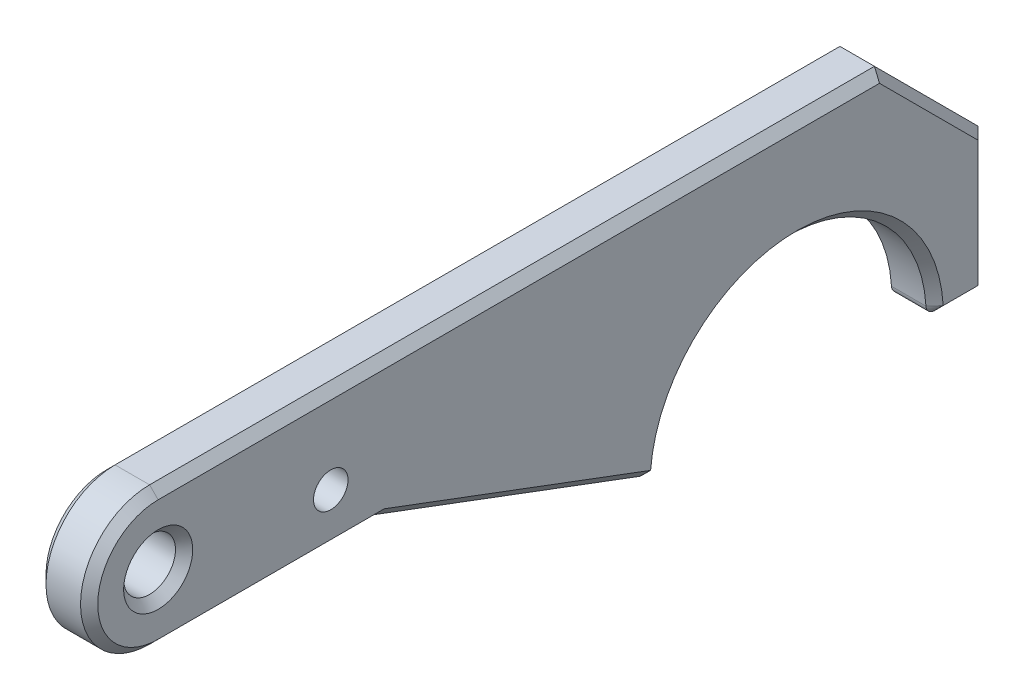
from build123d import *

# Parameters (mm, degrees)
SKETCH1_R           = 4.7625
BOSS_EXTRUDE1_DEPTH = 4.7625
FILLET1_R           = 1.5875
CHAMFER1_SIZE       = 19.05
CHAMFER2_SIZE       = 1.5875
SKETCH3_R           = 3.175
CUT_EXTRUDE1_DEPTH  = 156.963290953


with BuildPart() as part:
    # Sketch1 → Boss-Extrude1 (new, symmetric)
    with BuildSketch(Plane(origin=(0, 0, 0), x_dir=(0, 0, -1), z_dir=(1, 0, 0))):
        with BuildLine():
            Line((152.4, 12.7), (0, 12.7))
            ThreePointArc((0, 12.7), (-12.7, 0), (0, -12.7))
            Line((0, -12.7), (41.275, -12.7))
            Line((41.275, -12.7), (92.075, -31.75))
            ThreePointArc((92.075, -31.75), (117.475, -6.35), (142.875, -31.75))
            Line((142.875, -31.75), (152.4, -31.75))
            Line((152.4, -31.75), (152.4, 12.7))
        make_face()
        Circle(SKETCH1_R, mode=Mode.SUBTRACT)
    extrude(amount=BOSS_EXTRUDE1_DEPTH, both=True)

    # Fillet1
    fillet1_edges = [part.edges().sort_by_distance(p)[0] for p in [
        (0, -31.75, -142.875),
        (0, -31.75, -92.075),
    ]]
    fillet(fillet1_edges, radius=FILLET1_R)

    # Chamfer1
    chamfer1_edges = [part.edges().sort_by_distance(p)[0] for p in [
        (0, 12.7, -152.4),
    ]]
    chamfer(chamfer1_edges, length=CHAMFER1_SIZE)

    # Chamfer2
    chamfer2_edges = [part.edges().sort_by_distance(p)[0] for p in [
        (4.7625, 3.175, -142.875),
        (4.7625, -19.05, -152.4),
        (4.7625, -31.75, -148.407884182),
        (4.7625, -31.317575914, -143.326752348),
        (4.7625, -6.351954405, -117.79008725),
        (4.7625, -30.836121013, -91.430777232),
        (4.7625, -21.840530794, -65.649748785),
        (4.7625, -12.7, -20.6375),
        (4.7625, 0, 12.7),
        (4.7625, 12.7, -66.675),
        (-4.7625, 0, 4.7625),
        (-4.7625, 0, 12.7),
        (-4.7625, -12.7, -20.6375),
        (-4.7625, -21.840530794, -65.649748785),
        (-4.7625, -30.836121013, -91.430777232),
        (-4.7625, -6.351954405, -117.79008725),
        (-4.7625, -31.317575914, -143.326752348),
        (-4.7625, -31.75, -148.407884182),
        (-4.7625, -19.05, -152.4),
        (-4.7625, 3.175, -142.875),
        (-4.7625, 12.7, -66.675),
        (4.7625, 0, 4.7625),
    ]]
    chamfer(chamfer2_edges, length=CHAMFER2_SIZE)

    # Sketch3 → Cut-Extrude1 (cut, through all)
    with BuildSketch(Plane(origin=(4.7625, 0, 0), x_dir=(0, 0, -1), z_dir=(1, 0, 0))):
        with Locations((31.75, -3.175)):
            Circle(SKETCH3_R)
    extrude(amount=-CUT_EXTRUDE1_DEPTH, mode=Mode.SUBTRACT)


solid = part.part
